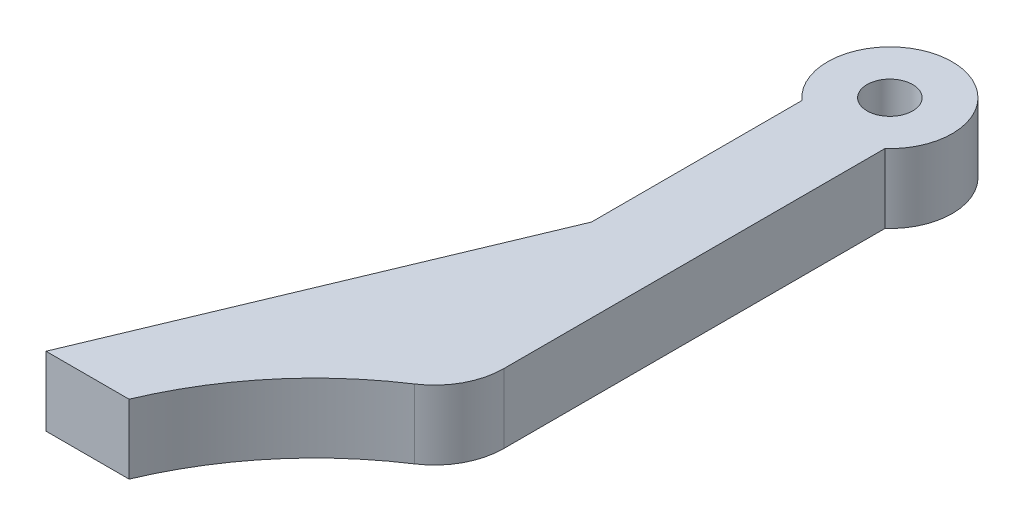
from build123d import *

# Parameters (mm, degrees)
EXTRUDE_2_DEPTH     = 5
SKETCH_4_R          = 1.65
CUT_EXTRUDE_1_DEPTH = 5
EXTRUDE_3_DEPTH     = 5
CUT_EXTRUDE_START   = -4.5
SKETCH_7_R          = 3
CUT_EXTRUDE_2_DEPTH = 3
CUT_EXTRUDE_3_DEPTH = 7.5
EXTRUDE_4_DEPTH     = 5
FILLET_1_R          = 5
FILLET_2_R          = 5
CUT_EXTRUDE_4_DEPTH = 5


with BuildPart() as part:
    # 草图3 → 凸台-拉伸2 (new body)
    with BuildSketch(Plane(origin=(0, 0, 0), x_dir=(1, 0, 0), z_dir=(0, 1, 0))):
        with BuildLine():
            Line((-3, -3.354101966), (-3, -7.416198487))
            Line((-3, -7.416198487), (-3, -43.854101966))
            Line((-3, -43.854101966), (3, -43.854101966))
            Line((3, -43.854101966), (3, -10.583005244))
            Line((3, -10.583005244), (3, -7.416198487))
            Line((3, -7.416198487), (3, -3.354101966))
            ThreePointArc((3, -3.354101966), (0, 4.5), (-3, -3.354101966))
        make_face()
    extrude(amount=EXTRUDE_2_DEPTH)

    # 草图4 → 切除-拉伸1 (cut)
    with BuildSketch(Plane(origin=(0, 5, 0), x_dir=(1, 0, 0), z_dir=(0, 1, 0))):
        with Locations(Location((0, 0, 0), (0, 0, 270))):
            Circle(SKETCH_4_R)
    extrude(amount=-CUT_EXTRUDE_1_DEPTH, mode=Mode.SUBTRACT)

    # 草图6 → 凸台-拉伸3 (add)
    with BuildSketch(Plane(origin=(0, 5, 0), x_dir=(1, 0, 0), z_dir=(0, 1, 0))):
        with BuildLine():
            Line((3, -33.74604712), (-3, -33.74604712))
            ThreePointArc((-3, -33.74604712), (-16.46902092, -57.986607816), (0.722500961, -79.745993902))
            Line((0.722500961, -79.745993902), (1.949520222, -77.620734201))
            ThreePointArc((1.949520222, -77.620734201), (-10.543317179, -55.371702353), (3, -33.74604712))
        make_face()
    extrude(amount=-EXTRUDE_3_DEPTH)

    # 草图7 → 切除-拉伸2 (cut)
    with BuildSketch(Plane(origin=(0, 5, 0), x_dir=(1, 0, 0), z_dir=(0, 1, 0)).offset(CUT_EXTRUDE_START)):
        with Locations(Location((0, 0, 0), (0, 0, 270))):
            Circle(SKETCH_7_R)
    extrude(amount=-CUT_EXTRUDE_2_DEPTH, mode=Mode.SUBTRACT)

    # 草图8 → 切除-拉伸3 (cut)
    with BuildSketch(Plane(origin=(0, 5, 0), x_dir=(1, 0, 0), z_dir=(0, 1, 0))):
        with BuildLine():
            Line((-3, -38.067187498), (-3, -43.854101966))
            Line((-3, -43.854101966), (3, -43.854101966))
            Line((3, -43.854101966), (3, -33.74604712))
            ThreePointArc((3, -33.74604712), (-0.160637142, -35.683569047), (-3, -38.067187498))
        make_face()
    extrude(amount=-CUT_EXTRUDE_3_DEPTH, mode=Mode.SUBTRACT)

    # 草图9 → 凸台-拉伸4 (add)
    with BuildSketch(Plane(origin=(0, 5, 0), x_dir=(1, 0, 0), z_dir=(0, 1, 0))):
        with BuildLine():
            Line((-3, -18.550074543), (-14.614967684, -46.324924269))
            ThreePointArc((-14.614967684, -46.324924269), (-9.917875534, -39.010182445), (-3, -33.74604712))
            Line((-3, -33.74604712), (-3, -18.550074543))
        make_face()
    extrude(amount=-EXTRUDE_4_DEPTH)

    # 圆角1
    fillet_1_edges = [part.edges().sort_by_distance(p)[0] for p in [
        (3, 2.5, 33.74604712),
    ]]
    fillet(fillet_1_edges, radius=FILLET_1_R)

    # 圆角2
    # the kernel refuses this fillet: 5 mm, written as the material it takes off along each edge
    with BuildSketch(Plane(origin=(1.949520222, 14.371610933, 77.620734201), x_dir=(-0.8261015944022844, 0, -0.5635212114250925), z_dir=(0, -1, 0))) as fillet_2_piece_1:
        with BuildLine():
            CenterArc((4.123508811, -4.985927863), FILLET_2_R, 94.299664485, 55.185648669)
            Line((-0.183986354, -2.447131808), (-0.270136257, -2.396355887))
            ThreePointArc((-0.270136257, -2.396355887), (-0.191711734, -1.216068615), (-0.099718557, 0.007497289))
            Line((-0.099718557, 0.007497289), (0.007497289, 0.099718557))
            ThreePointArc((0.007497289, 0.099718557), (1.874322187, 0.029639314), (3.741147084, 0.099718557))
            Line((3.741147084, 0.099718557), (3.748644373, 0))
        make_face()
    extrude(amount=23.743221866, mode=Mode.SUBTRACT)

    # 草图10 → 切除-拉伸4 (cut)
    with BuildSketch(Plane(origin=(0, 5, 0), x_dir=(1, 0, 0), z_dir=(0, 1, 0))):
        with BuildLine():
            Line((-14.614967684, -46.324924269), (-8.614967684, -46.324924269))
            ThreePointArc((-8.614967684, -46.324924269), (-9.770106213, -62.167654699), (-1.147240872, -75.508293582))
            ThreePointArc((-1.147240872, -75.508293582), (0.307928877, -77.397579493), (0.722500961, -79.745993902))
            ThreePointArc((0.722500961, -79.745993902), (-14.272081884, -66.397409294), (-14.614967684, -46.324924269))
        make_face()
    extrude(amount=-CUT_EXTRUDE_4_DEPTH, mode=Mode.SUBTRACT)


solid = part.part
